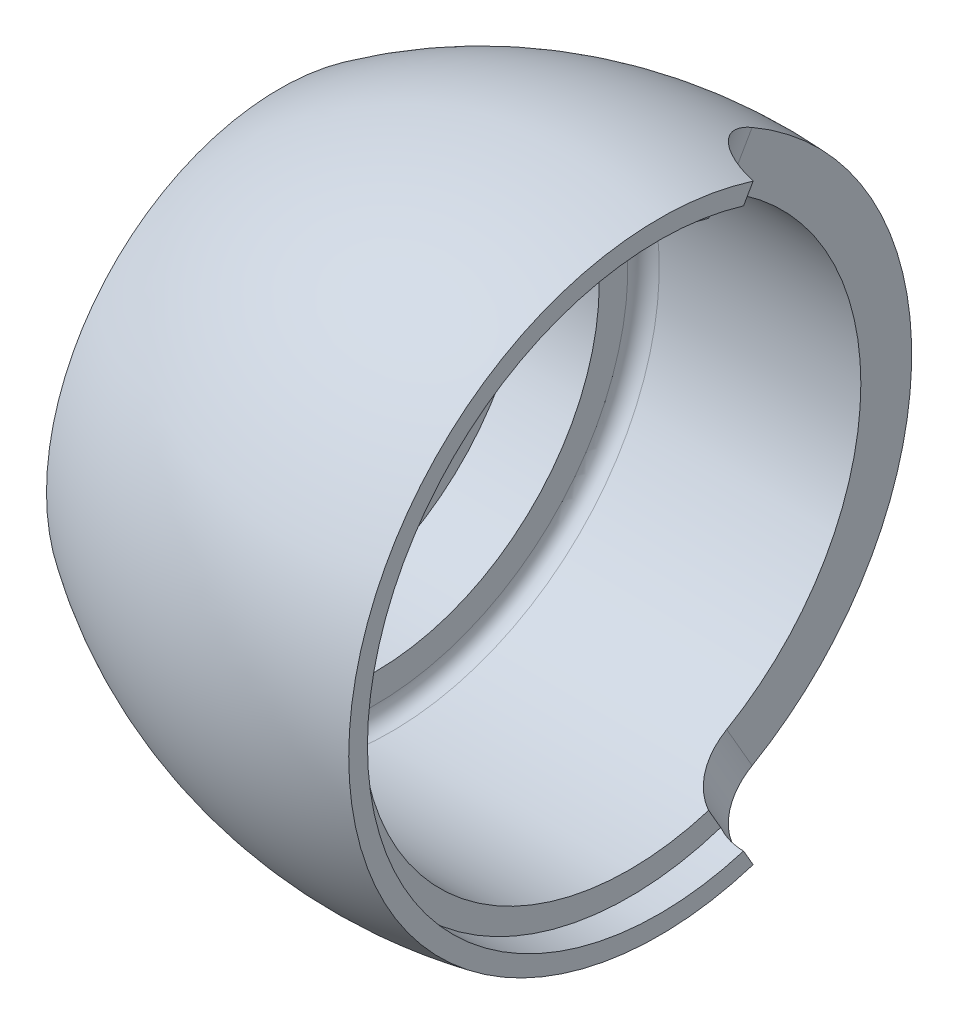
from build123d import *

# Parameters (mm, degrees)
FILLET1_R          = 2.54
SKETCH9_R          = 10.795
CUT_EXTRUDE4_DEPTH = 57.912
SKETCH10_W         = 29.440232171
SKETCH10_H         = 20.164243688
CUT_REVOLVE2_ANGLE = 120


with BuildPart() as part:
    # Sketch1 → Revolve1 (revolve)
    with BuildSketch(Plane.XY):
        with BuildLine():
            Line((-38.608, 0), (-38.608, 22.86))
            Line((-38.608, 22.86), (-41.91, 22.86))
            Line((-41.91, 22.86), (-42.21, 22.86))
            Line((-42.21, 22.86), (-42.21, 31.75))
            Line((-42.21, 31.75), (-41.91, 31.75))
            Line((-41.91, 31.75), (-41.91, 36.2585))
            Line((-41.91, 36.2585), (-30.226, 36.2585))
            Line((-30.226, 36.2585), (-30.226, 43.434))
            Line((-30.226, 43.434), (10.948, 43.434))
            Line((10.948, 43.434), (10.948, 47.244))
            Line((10.948, 47.244), (15.748, 47.244))
            Line((15.748, 47.244), (15.748, 50.275820015))
            ThreePointArc((15.748, 50.275820015), (-16.244349986, 50.176187679), (-45.72, 37.738083301))
            Line((-45.72, 37.738083301), (-45.72, 19.05))
            Line((-45.72, 19.05), (-42.418, 19.05))
            Line((-42.418, 19.05), (-42.418, 0))
            Line((-42.418, 0), (-38.608, 0))
        make_face()
    revolve(axis=Axis((-42.418, 0, 0), (1, 0, 0)))

    # Fillet1
    fillet1_edges = [part.edges().sort_by_distance(p)[0] for p in [
        (-30.226, -43.434, 0),
    ]]
    fillet(fillet1_edges, radius=FILLET1_R)

    # Sketch9 → Cut-Extrude4 (cut)
    with BuildSketch(Plane(origin=(0, 0, 0), x_dir=(1, 0, 0), z_dir=(0, -0.8660254037844416, 0.49999999999999495))):
        with Locations((15.748, 0)):
            Circle(SKETCH9_R)
    cut_extrude4 = extrude(amount=-CUT_EXTRUDE4_DEPTH, mode=Mode.SUBTRACT)

    # Mirror3: Cut-Extrude4 across plane
    add(cut_extrude4.mirror(Plane.ZX), mode=Mode.SUBTRACT)

    # Sketch10 → Cut-Revolve2 (revolve, cut)
    with BuildSketch(Plane(origin=(0, 0, 0), x_dir=(1, 0, 0), z_dir=(0, -0.49999999999999495, -0.8660254037844416))):
        with Locations((19.673116086, -46.635825172)):
            Rectangle(SKETCH10_W, SKETCH10_H)
    revolve(axis=Axis((-48.7934, 0, 0), (-1, 0, 0)), revolution_arc=CUT_REVOLVE2_ANGLE, mode=Mode.SUBTRACT)


solid = part.part
